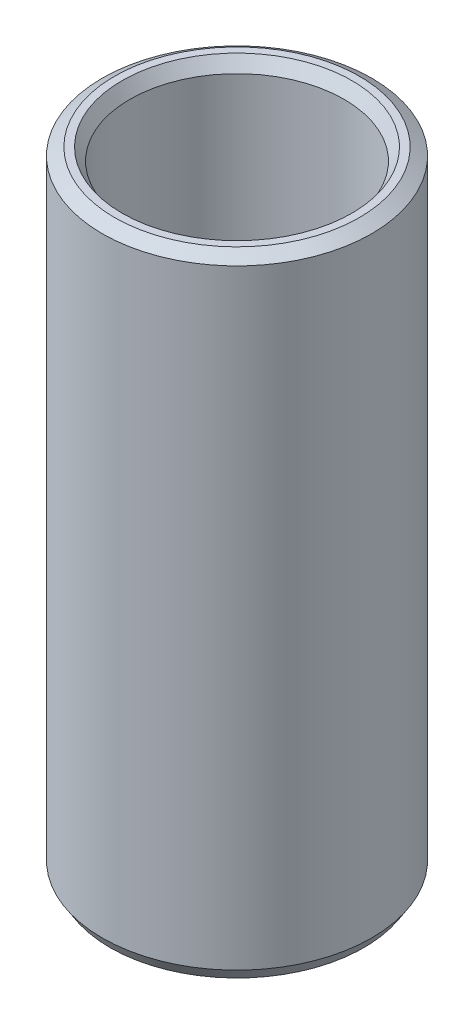
from build123d import *
from OCP.BRepFilletAPI import BRepFilletAPI_MakeChamfer

# Parameters (mm, degrees)
SKETCH1_R           = 35
BOSS_EXTRUDE1_DEPTH = 163.638054038
SKETCH2_R           = 27.819987728
CUT_EXTRUDE1_DEPTH  = 171.960266522
CHAMFER1_SIZE       = 2.026600507
CHAMFER1_SIZE2      = 3.197347798


with BuildPart() as part:
    # Sketch1 → Boss-Extrude1 (new body)
    with BuildSketch(Plane(origin=(0, 0, 0), x_dir=(1, 0, 0), z_dir=(0, 1, 0))):
        Circle(SKETCH1_R)
    extrude(amount=BOSS_EXTRUDE1_DEPTH)

    # Sketch2 → Cut-Extrude1 (cut, through all)
    with BuildSketch(Plane(origin=(0, 0, 0), x_dir=(1, 0, 0), z_dir=(0, 1, 0))):
        Circle(SKETCH2_R)
    extrude(amount=CUT_EXTRUDE1_DEPTH, mode=Mode.SUBTRACT)

    # Chamfer1: one chamfer whose edges measure the first distance from different faces: ONE call of the kernel's chamfer builder (chamfer() names one face for all edges)
    chamfer1_edges_1 = [part.edges().sort_by_distance(p)[0] for p in [
        (-27.819987728, 163.638054038, 0),
    ]]
    chamfer1_side_1 = [part.faces().sort_by_distance(p)[0] for p in [
        (-34.010050506, 163.638054038, 0),
    ]]
    chamfer1_edges_2 = [part.edges().sort_by_distance(p)[0] for p in [
        (-27.819987728, 0, 0),
    ]]
    chamfer1_side_2 = [part.faces().sort_by_distance(p)[0] for p in [
        (-27.819987728, 81.819027019, 0),
    ]]
    chamfer1_edges_3 = [part.edges().sort_by_distance(p)[0] for p in [
        (-35, 0, 0),
    ]]
    chamfer1_side_3 = [part.faces().sort_by_distance(p)[0] for p in [
        (-34.010050506, 0, 0),
    ]]
    chamfer1_edges_4 = [part.edges().sort_by_distance(p)[0] for p in [
        (-35, 163.638054038, 0),
    ]]
    chamfer1_side_4 = [part.faces().sort_by_distance(p)[0] for p in [
        (-35, 81.819027019, 0),
    ]]
    chamfer1 = BRepFilletAPI_MakeChamfer(part.part.solid().wrapped)
    for e in chamfer1_edges_1:
        chamfer1.Add(CHAMFER1_SIZE, CHAMFER1_SIZE2, e.wrapped, chamfer1_side_1[0].wrapped)  # the first distance lies on this face
    for e in chamfer1_edges_2:
        chamfer1.Add(CHAMFER1_SIZE, CHAMFER1_SIZE2, e.wrapped, chamfer1_side_2[0].wrapped)  # the first distance lies on this face
    for e in chamfer1_edges_3:
        chamfer1.Add(CHAMFER1_SIZE, CHAMFER1_SIZE2, e.wrapped, chamfer1_side_3[0].wrapped)  # the first distance lies on this face
    for e in chamfer1_edges_4:
        chamfer1.Add(CHAMFER1_SIZE, CHAMFER1_SIZE2, e.wrapped, chamfer1_side_4[0].wrapped)  # the first distance lies on this face
    add(Compound.cast(chamfer1.Shape()), mode=Mode.REPLACE)


solid = part.part
